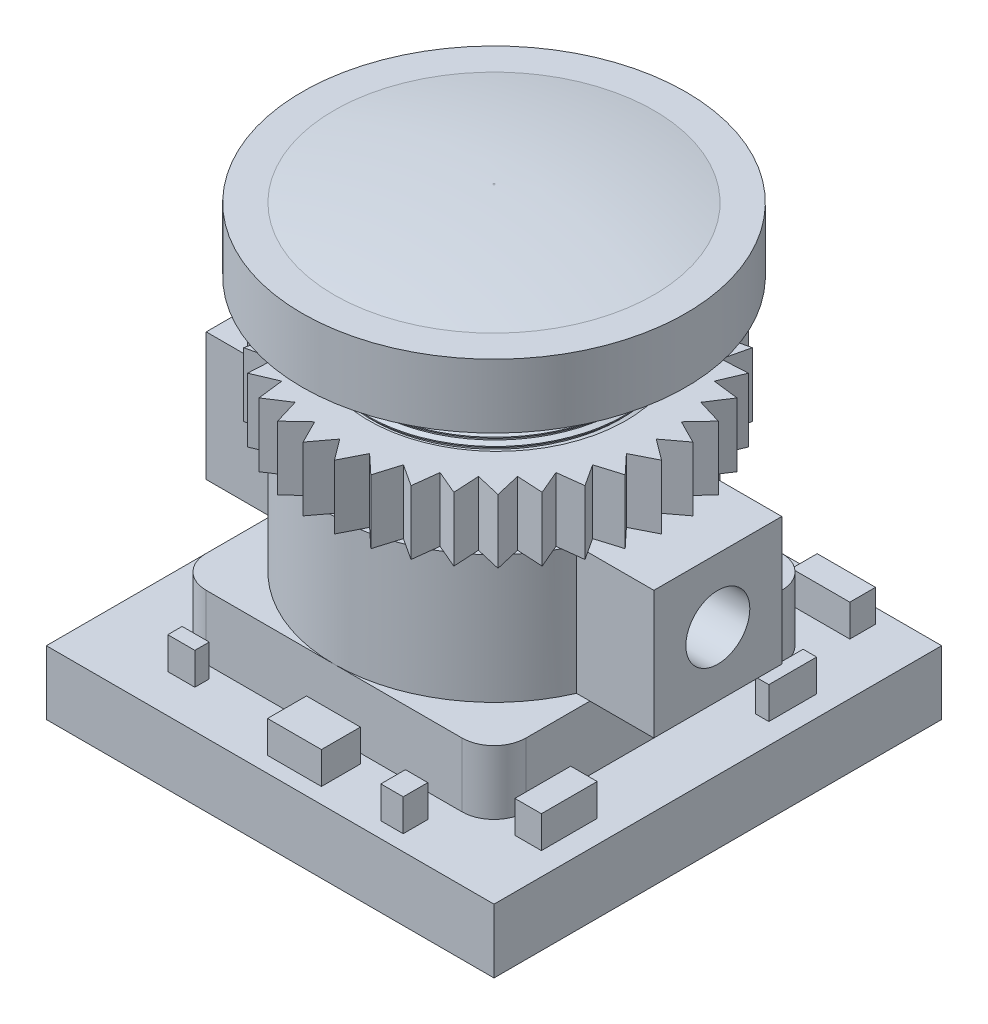
from build123d import *

# Parameters (mm, degrees)
SKETCH1_W            = 14
SKETCH1_H            = 14
BOSS_EXTRUDE1_DEPTH  = 2
SKETCH2_W            = 10
SKETCH2_H            = 10
BOSS_EXTRUDE3_DEPTH  = 2
FILLET1_R            = 1
FILLET2_R            = 1
SKETCH4_W            = 0.708673759
SKETCH4_H            = 0.864236292
SKETCH4_W_2          = 0.97658701
SKETCH4_H_2          = 1.313639163
SKETCH4_W_3          = 0.302482702
SKETCH4_H_3          = 1.253142623
SKETCH4_W_4          = 0.846951566
SKETCH4_H_4          = 0.449402871
SKETCH4_W_5          = 1.685260768
SKETCH4_H_5          = 1.218573171
SKETCH4_W_6          = 0.700031396
SKETCH4_H_6          = 0.769170299
SKETCH4_W_7          = 0.82966684
SKETCH4_H_7          = 1.745757309
SKETCH4_W_8          = 0.423475783
SKETCH4_H_8          = 1.495128785
SKETCH4_W_9          = 1.823538575
SKETCH4_H_9          = 0.803739751
SKETCH4_W_10         = 1.538340598
SKETCH4_H_10         = 1.581552414
SKETCH4_W_11         = 0.311125064
SKETCH4_H_11         = 0.553111226
SKETCH4_W_12         = 0.993871735
SKETCH4_H_12         = 0.561753589
SKETCH4_W_13         = 0.656819581
SKETCH4_H_13         = 0.700031396
BOSS_EXTRUDE4_DEPTH  = 1
SKETCH5_R            = 5
BOSS_EXTRUDE5_DEPTH  = 4
BOSS_EXTRUDE9_DEPTH  = 4
BOSS_EXTRUDE10_DEPTH = 2
SKETCH9_R            = 4.021634228
BOSS_EXTRUDE11_DEPTH = 2
THREAD1_PITCH        = 0.25
SKETCH14_R           = 6
BOSS_EXTRUDE12_DEPTH = 2
SKETCH20_R           = 1
CUT_EXTRUDE1_DEPTH   = 2
CUT_EXTRUDE2_START   = -2
SKETCH21_R           = 1
CUT_EXTRUDE2_DEPTH   = 2
SKETCH22_R           = 5
BOSS_EXTRUDE13_DEPTH = 0.5
FILLET3_R            = 25


with BuildPart() as part:
    # Sketch1 → Boss-Extrude1 (new body)
    with BuildSketch(Plane(origin=(0, 0, 0), x_dir=(1, 0, 0), z_dir=(0, 1, 0))):
        with Locations((7, 7)):
            Rectangle(SKETCH1_W, SKETCH1_H)
    extrude(amount=BOSS_EXTRUDE1_DEPTH)

    # Sketch2 → Boss-Extrude3 (add)
    with BuildSketch(Plane(origin=(0, 2, 0), x_dir=(1, 0, 0), z_dir=(0, 1, 0))):
        with Locations((7, 7)):
            Rectangle(SKETCH2_W, SKETCH2_H)
    extrude(amount=BOSS_EXTRUDE3_DEPTH)

    # Fillet1
    fillet1_edges = [part.edges().sort_by_distance(p)[0] for p in [
        (2, 3, -2),
    ]]
    fillet(fillet1_edges, radius=FILLET1_R)

    # Fillet2
    fillet2_edges = [part.edges().sort_by_distance(p)[0] for p in [
        (12, 3, -12),
        (2, 3, -12),
        (12, 3, -2),
    ]]
    fillet(fillet2_edges, radius=FILLET2_R)

    # Sketch4 → Boss-Extrude4 (add)
    with BuildSketch(Plane(origin=(0, 2, 0), x_dir=(1, 0, 0), z_dir=(0, 1, 0))):
        with Locations((1.30468284, 10.305703815)):
            Rectangle(SKETCH4_W, SKETCH4_H)
        with Locations((1.170726214, 7.073460085)):
            Rectangle(SKETCH4_W_2, SKETCH4_H_2)
        with Locations((1.162083851, 4.415933489)):
            Rectangle(SKETCH4_W_3, SKETCH4_H_3)
        with Locations((3.024513059, 1.421354739)):
            Rectangle(SKETCH4_W_4, SKETCH4_H_4)
        with Locations((7.272234432, 1.09726613)):
            Rectangle(SKETCH4_W_5, SKETCH4_H_5)
        with Locations((10.322988541, 0.872564694)):
            Rectangle(SKETCH4_W_6, SKETCH4_H_6)
        with Locations((12.876806782, 3.063403693)):
            Rectangle(SKETCH4_W_7, SKETCH4_H_7)
        with Locations((13.140398851, 9.990257569)):
            Rectangle(SKETCH4_W_8, SKETCH4_H_8)
        with Locations((11.472422809, 13.144720033)):
            Rectangle(SKETCH4_W_9, SKETCH4_H_9)
        with Locations((7.501257049, 12.971872774)):
            Rectangle(SKETCH4_W_10, SKETCH4_H_10)
        with Locations((5.988843539, 12.803346697)):
            Rectangle(SKETCH4_W_11, SKETCH4_H_11)
        with Locations((2.951052975, 13.023726952)):
            Rectangle(SKETCH4_W_12, SKETCH4_H_12)
        with Locations((1.166405033, 12.392834459)):
            Rectangle(SKETCH4_W_13, SKETCH4_H_13)
    extrude(amount=BOSS_EXTRUDE4_DEPTH)

    # Sketch5 → Boss-Extrude5 (add)
    with BuildSketch(Plane(origin=(0, 4, 0), x_dir=(1, 0, 0), z_dir=(0, 1, 0))):
        with Locations(Location((7, 7, 0), (0, 0, 270))):
            Circle(SKETCH5_R)
    extrude(amount=BOSS_EXTRUDE5_DEPTH)

    # Sketch7 → Boss-Extrude9 (add)
    with BuildSketch(Plane(origin=(0, 4, 0), x_dir=(1, 0, 0), z_dir=(0, 1, 0))):
        with BuildLine():
            ThreePointArc((2.417424305, 5), (2, 7), (2.417424305, 9))
            Line((2.417424305, 9), (0, 9))
            Line((0, 9), (0, 5))
            Line((0, 5), (2.417424305, 5))
        make_face()
        with BuildLine():
            Line((11.582575695, 5), (14, 5))
            Line((14, 5), (14, 9))
            Line((14, 9), (11.582575695, 9))
            ThreePointArc((11.582575695, 9), (12, 7), (11.582575695, 5))
        make_face()
    extrude(amount=BOSS_EXTRUDE9_DEPTH)

    # Sketch8 → Boss-Extrude10 (add)
    with BuildSketch(Plane(origin=(0, 8, 0), x_dir=(1, 0, 0), z_dir=(0, 1, 0))):
        Polygon((3.809357865, 3.342421928), (3.764790845, 2.526644019), (4.516128509, 2.847535795), (4.61389691, 2.036412404), (5.298097794, 2.482897529), (5.535230972, 1.701074229), (6.131505979, 2.259586479), (6.500798763, 1.530818576), (6.991030378, 2.184387838), (7.481261993, 1.530818576), (7.850554776, 2.259586479), (8.446829783, 1.701074229), (8.683962961, 2.482897529), (9.368163845, 2.036412404), (9.465932246, 2.847535795), (10.21726991, 2.526644019), (10.17270289, 3.342421928), (10.968348319, 3.156873635), (10.782800025, 3.952519063), (11.598577935, 3.907952044), (11.277686158, 4.659289707), (12.08880955, 4.757058108), (11.642324424, 5.441258992), (12.424147724, 5.67839217), (11.865635474, 6.274667177), (12.594403377, 6.643959961), (11.940834115, 7.134191576), (12.594403377, 7.624423191), (11.865635474, 7.993715975), (12.424147724, 8.589990981), (11.642324424, 8.827124159), (12.08880955, 9.511325043), (11.277686158, 9.609093444), (11.598577935, 10.360431108), (10.782800025, 10.315864089), (10.968348319, 11.111509517), (10.17270289, 10.925961223), (10.21726991, 11.741739133), (9.465932246, 11.420847356), (9.368163845, 12.231970748), (8.683962961, 11.785485622), (8.446829783, 12.567308922), (7.850554776, 12.008796672), (7.481261993, 12.737564575), (6.991030378, 12.083995313), (6.500798763, 12.737564576), (6.131505979, 12.008796672), (5.535230972, 12.567308922), (5.298097794, 11.785485622), (4.61389691, 12.231970748), (4.516128509, 11.420847356), (3.764790845, 11.741739133), (3.809357865, 10.925961223), (3.013712436, 11.111509517), (3.19926073, 10.315864088), (2.38348282, 10.360431108), (2.704374597, 9.609093444), (1.893251205, 9.511325043), (2.339736331, 8.827124159), (1.557913031, 8.589990981), (2.116425281, 7.993715975), (1.387657378, 7.624423191), (2.04122664, 7.134191576), (1.387657378, 6.643959961), (2.116425281, 6.274667177), (1.557913031, 5.67839217), (2.339736331, 5.441258992), (1.893251205, 4.757058108), (2.704374597, 4.659289707), (2.38348282, 3.907952044), (3.19926073, 3.952519063), (3.013712436, 3.156873635), align=None)
    extrude(amount=BOSS_EXTRUDE10_DEPTH)

    # Sketch9 → Boss-Extrude11 (add)
    with BuildSketch(Plane(origin=(0, 10, 0), x_dir=(1, 0, 0), z_dir=(0, 1, 0))):
        with Locations(Location((6.948145823, 7.159883714, 0), (0, 0, 270))):
            Circle(SKETCH9_R)
    extrude(amount=BOSS_EXTRUDE11_DEPTH)

    # Thread1: the profile of Thread Profile1 profile screwed along a right-hand helix of 8 turns, 6 arcs to a turn; built about Z, then put on its axis
    thread1_z = Axis((0, 0, 0), (0, 0, 1))
    thread1_corners = [(4.021934228, 1e-09, -0.000173205), (4.021934228, 1e-09, 0.218923204), (3.88631776, 1e-09, 0.140625), (3.88631776, 1e-09, 0.078125)]
    with BuildLine(mode=Mode.PRIVATE) as thread1_profile:
        Line(thread1_corners[0], thread1_corners[1])
        Line(thread1_corners[1], thread1_corners[2])
        Line(thread1_corners[2], thread1_corners[3])
        Line(thread1_corners[3], thread1_corners[0])
    thread1_cap = Face(thread1_profile.wire())
    thread1_turn_angles = [0, 30, 60, 90, 120, 150, 180, 210, 240, 270, 300, 330, 360]
    thread1_turn_weights = [1, 0.8660254037844387, 1, 0.8660254037844387, 1, 0.8660254037844387, 1, 0.8660254037844387, 1, 0.8660254037844387, 1, 0.8660254037844387, 1]
    thread1_turn_rails = [Edge.make_bspline([Vector(p[0], p[1], 0).rotate(thread1_z, thread1_turn_angles[k]) / thread1_turn_weights[k] + Vector(0, 0, p[2] + THREAD1_PITCH * thread1_turn_angles[k] / 360) for k in range(13)], [0, 0, 0, 1, 1, 2, 2, 3, 3, 4, 4, 5, 5, 6, 6, 6], 2, thread1_turn_weights) for p in thread1_corners]
    thread1_turn_sides = [Face.make_surface_from_curves(thread1_turn_rails[p[0]], thread1_turn_rails[p[1]]) for p in [(0, 1), (1, 2), (2, 3), (3, 0)]]
    thread1 = Plane(origin=(6.948145823, 11.9999, -7.159883714), x_dir=(-0.974370065, 0, -0.224951054), z_dir=(0, -1, 0)) * Solid(Shell([*[p.moved(Location((0, 0, THREAD1_PITCH * i))) for i in range(8) for p in thread1_turn_sides], thread1_cap, thread1_cap.rotate(thread1_z, 2880).moved(Location((0, 0, THREAD1_PITCH * 2880 / 360)))]))
    add(thread1, mode=Mode.SUBTRACT)

    # Sketch14 → Boss-Extrude12 (add)
    with BuildSketch(Plane(origin=(0, 12, 0), x_dir=(1, 0, 0), z_dir=(0, 1, 0))):
        with Locations(Location((7, 7, 0), (0, 0, 270))):
            Circle(SKETCH14_R)
    extrude(amount=BOSS_EXTRUDE12_DEPTH)

    # Sketch20 → Cut-Extrude1 (cut)
    with BuildSketch(Plane.ZY):
        with Locations((-7, 6)):
            Circle(SKETCH20_R)
    extrude(amount=-CUT_EXTRUDE1_DEPTH, mode=Mode.SUBTRACT)

    # Sketch21 → Cut-Extrude2 (cut)
    with BuildSketch(Plane(origin=(14, 0, 0), x_dir=(0, 0, -1), z_dir=(1, 0, 0)).offset(CUT_EXTRUDE2_START)):
        with Locations(Location((7, 6, 0), (0, 0, 180))):
            Circle(SKETCH21_R)
    extrude(amount=CUT_EXTRUDE2_DEPTH, mode=Mode.SUBTRACT)

    # Sketch22 → Boss-Extrude13 (add)
    with BuildSketch(Plane(origin=(0, 14, 0), x_dir=(1, 0, 0), z_dir=(0, 1, 0))):
        with Locations(Location((7, 7, 0), (0, 0, 270))):
            Circle(SKETCH22_R)
    extrude(amount=BOSS_EXTRUDE13_DEPTH)

    # Fillet3
    # the kernel refuses this fillet: 25 mm, written as the material it takes off along each edge
    with BuildSketch(Plane(origin=(7, 14.5, -7), x_dir=(0, 0, 1), z_dir=(-1, 0, 0))) as fillet3_piece_1:
        with BuildLine():
            CenterArc((0.025062814, -25), FILLET3_R, 78.521659045, 11.478340955)
            Line((0.025062814, 0), (0.025062814, 0.5))
            Line((0.025062814, 0.5), (5, 0.5))
            Line((5, 0.5), (5.5, 0))
            ThreePointArc((5.5, 0), (5.5, -0.25), (5.099498744, -0.01))
            Line((5.099498744, -0.01), (5, -0.5))
        make_face()
    revolve(axis=Axis((7, 14.5, -7), (0, 1, 0)), mode=Mode.SUBTRACT)


solid = part.part
